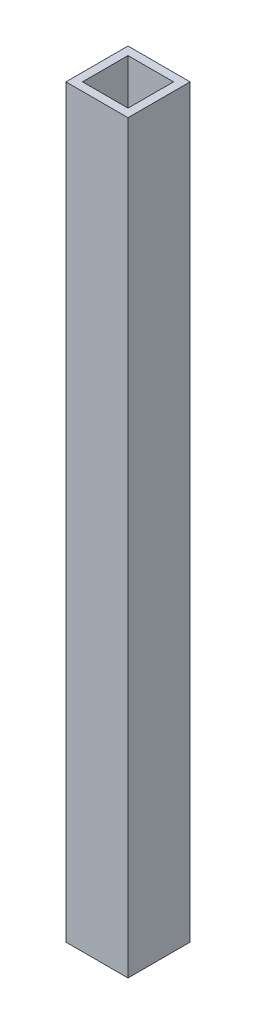
from build123d import *

# Parameters (mm, degrees)
SKETCH1_W           = 15
SKETCH1_H           = 15
SKETCH1_W_2         = 11
SKETCH1_H_2         = 11
BOSS_EXTRUDE1_DEPTH = 180


with BuildPart() as part:
    # Sketch1 → Boss-Extrude1 (new body)
    with BuildSketch(Plane(origin=(0, 0, 0), x_dir=(1, 0, 0), z_dir=(0, 1, 0))):
        with Locations((7.5, 7.5)):
            Rectangle(SKETCH1_W, SKETCH1_H)
        with Locations((7.5, 7.5)):
            Rectangle(SKETCH1_W_2, SKETCH1_H_2, mode=Mode.SUBTRACT)
    extrude(amount=BOSS_EXTRUDE1_DEPTH)


solid = part.part
